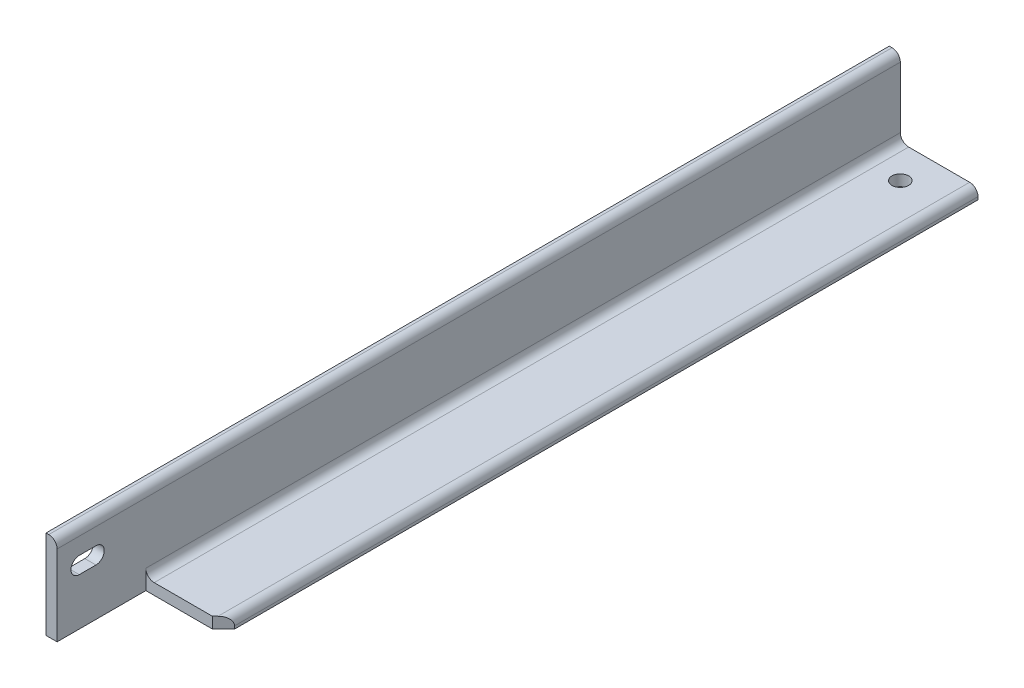
from build123d import *

# Parameters (mm, degrees)
BOSS_EXTRUDE1_DEPTH             = 482.6
CUT_EXTRUDE1_REACH              = 505.535
CUT_EXTRUDE2_REACH              = 505.535
F_3_4_0_75_DIAMETER_HOLE1_D     = 19.05
F_3_4_0_75_DIAMETER_HOLE1_DEPTH = 50.8
F_3_4_0_75_DIAMETER_HOLE1_TIP   = 5.723197396


with BuildPart() as part:
    # Sketch1 → Boss-Extrude1 (new, symmetric)
    with BuildSketch(Plane.XY):
        with BuildLine():
            Line((0, 0), (0, 101.6))
            Line((0, 101.6), (3.18008, 101.6))
            ThreePointArc((3.18008, 101.6), (9.911679988, 98.811679988), (12.7, 92.08008))
            Line((12.7, 92.08008), (12.7, 22.225))
            ThreePointArc((12.7, 22.225), (15.489807909, 15.489807909), (22.225, 12.7))
            Line((22.225, 12.7), (92.08008, 12.7))
            ThreePointArc((92.08008, 12.7), (98.811679988, 9.911679988), (101.6, 3.18008))
            Line((101.6, 3.18008), (101.6, 0))
            Line((101.6, 0), (0, 0))
        make_face()
    extrude(amount=BOSS_EXTRUDE1_DEPTH, both=True)

    # Sketch2 → Cut-Extrude1 (cut, up to next)
    with BuildSketch(Plane.XZ, mode=Mode.PRIVATE) as cut_extrude1_sk1:
        Polygon((88.9, 381), (12.7, 381), (12.7, 482.6), (101.6, 482.6), (101.6, 381), (101.6, 368.3), align=None)
    cut_extrude1_tool1 = extrude(cut_extrude1_sk1.sketch, amount=-CUT_EXTRUDE1_REACH, mode=Mode.PRIVATE) & part.part
    add(cut_extrude1_tool1.solids().sort_by_distance((57.5059, 0, 431.312979))[0], mode=Mode.SUBTRACT)

    # Sketch3 → Cut-Extrude2 (cut, up to next)
    with BuildSketch(Plane.ZY, mode=Mode.PRIVATE) as cut_extrude2_sk1:
        with BuildLine():
            Line((457.2, 53.975), (438.15, 53.975))
            ThreePointArc((438.15, 53.975), (428.625, 63.5), (438.15, 73.025))
            Line((438.15, 73.025), (457.2, 73.025))
            ThreePointArc((457.2, 73.025), (466.725, 63.5), (457.2, 53.975))
        make_face()
    cut_extrude2_tool1 = extrude(cut_extrude2_sk1.sketch, amount=-CUT_EXTRUDE2_REACH, mode=Mode.PRIVATE) & part.part
    add(cut_extrude2_tool1.solids().sort_by_distance((0, 63.5, 447.675))[0], mode=Mode.SUBTRACT)

    # 3/4 (0.75) Diameter Hole1
    with Locations(Plane.XZ):
        with Locations((50.8, -444.5)):
            Hole(F_3_4_0_75_DIAMETER_HOLE1_D / 2, depth=F_3_4_0_75_DIAMETER_HOLE1_DEPTH)
            with Locations((0, 0, -(F_3_4_0_75_DIAMETER_HOLE1_DEPTH + F_3_4_0_75_DIAMETER_HOLE1_TIP / 2))):  # 118° drill point
                Cone(0, F_3_4_0_75_DIAMETER_HOLE1_D / 2, F_3_4_0_75_DIAMETER_HOLE1_TIP, mode=Mode.SUBTRACT)


solid = part.part
